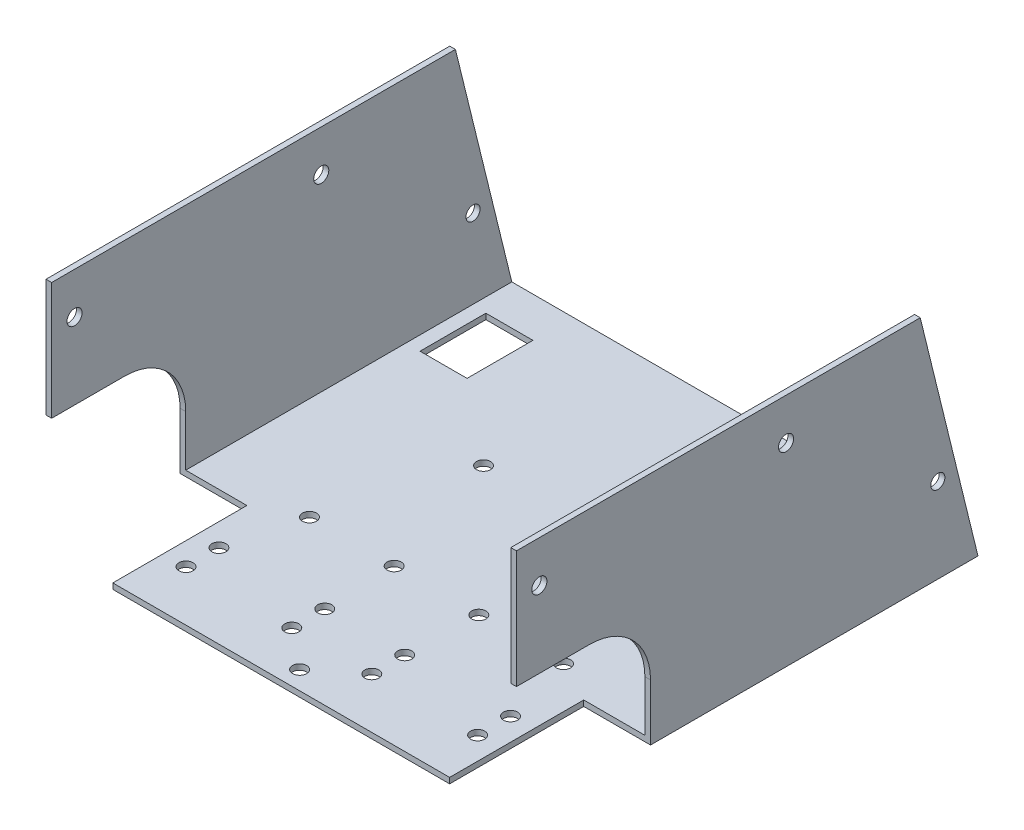
from build123d import *

# Parameters (mm, degrees)
SALIENTE_EXTRUIR1_DEPTH = 100
CROQUIS2_W              = 13
CROQUIS2_H              = 28.5
CORTAR_EXTRUIR2_DEPTH   = 10
CROQUIS3_R              = 1.5
CORTAR_EXTRUIR3_DEPTH   = 5
CROQUIS4_R              = 1.5
CORTAR_EXTRUIR4_DEPTH   = 10
CROQUIS5_R              = 1.5
CORTAR_EXTRUIR6_DEPTH   = 10
CORTAR_EXTRUIR8_DEPTH   = 151
CROQUIS7_W              = 1.2
CROQUIS7_H              = 2.5
CORTAR_EXTRUIR9_DEPTH   = 28.5
CROQUIS8_W              = 10
CROQUIS8_H              = 14
CORTAR_EXTRUIR10_DEPTH  = 10
CORTAR_EXTRUIR11_DEPTH  = 151
CROQUIS10_R             = 1.5
CORTAR_EXTRUIR12_DEPTH  = 149.746059648
CROQUIS11_R             = 1.6
CORTAR_EXTRUIR13_DEPTH  = 149.746059648


with BuildPart() as part:
    # Croquis1 → Saliente-Extruir1 (new body)
    with BuildSketch(Plane.XY):
        Polygon((50, 0), (-50, 0), (-50, 50), (-48.8, 50), (-48.8, 1.2), (48.8, 1.2), (48.8, 50), (50, 50), align=None)
    extrude(amount=-SALIENTE_EXTRUIR1_DEPTH)

    # Croquis2 → Cortar-Extruir2 (cut)
    with BuildSketch(Plane(origin=(0, 1.2, 0), x_dir=(1, 0, 0), z_dir=(0, 1, 0))):
        with Locations((-42.3, 14.25)):
            Rectangle(CROQUIS2_W, CROQUIS2_H)
        with Locations((42.3, 14.25)):
            Rectangle(CROQUIS2_W, CROQUIS2_H)
    extrude(amount=-CORTAR_EXTRUIR2_DEPTH, mode=Mode.SUBTRACT)

    # Croquis3 → Cortar-Extruir3 (cut)
    with BuildSketch(Plane(origin=(0, 1.2, 0), x_dir=(1, 0, 0), z_dir=(0, 1, 0))):
        with Locations((0, 3.9)):
            Circle(CROQUIS3_R)
    extrude(amount=-CORTAR_EXTRUIR3_DEPTH, mode=Mode.SUBTRACT)

    # Croquis4 → Cortar-Extruir4 (cut)
    with BuildSketch(Plane(origin=(0, 1.2, 0), x_dir=(1, 0, 0), z_dir=(0, 1, 0))):
        with Locations((-8.5, 17.75)):
            Circle(CROQUIS4_R)
        with Locations((-8.5, 10.75)):
            Circle(CROQUIS4_R)
        with Locations((8.5, 10.75)):
            Circle(CROQUIS4_R)
        with Locations((8.5, 17.75)):
            Circle(CROQUIS4_R)
        with Locations((-31, 17.75)):
            Circle(CROQUIS4_R)
        with Locations((-31, 10.75)):
            Circle(CROQUIS4_R)
        with Locations((31, 10.75)):
            Circle(CROQUIS4_R)
        with Locations((31, 17.75)):
            Circle(CROQUIS4_R)
    extrude(amount=-CORTAR_EXTRUIR4_DEPTH, mode=Mode.SUBTRACT)

    # Croquis5 → Cortar-Extruir6 (cut)
    with BuildSketch(Plane(origin=(0, 1.2, 0), x_dir=(1, 0, 0), z_dir=(0, 1, 0))):
        with Locations((-18, 61)):
            Circle(CROQUIS5_R)
        with Locations((-27, 33)):
            Circle(CROQUIS5_R)
        with Locations((27, 33)):
            Circle(CROQUIS5_R)
        with Locations((18, 61)):
            Circle(CROQUIS5_R)
        with Locations((-9, 33)):
            Circle(CROQUIS5_R)
        with Locations((9, 33)):
            Circle(CROQUIS5_R)
    extrude(amount=-CORTAR_EXTRUIR6_DEPTH, mode=Mode.SUBTRACT)

    # Croquis6 → Cortar-Extruir8 (cut, through all)
    with BuildSketch(Plane.ZY.offset(50)):
        with BuildLine():
            Line((0, 25), (0, 2.5))
            Line((0, 2.5), (-28.5, 2.5))
            Line((-28.5, 2.5), (-28.5, 12))
            ThreePointArc((-28.5, 12), (-24.692388155, 21.192388155), (-15.5, 25))
            Line((-15.5, 25), (0, 25))
        make_face()
    extrude(amount=-CORTAR_EXTRUIR8_DEPTH, mode=Mode.SUBTRACT)

    # Croquis7 → Cortar-Extruir9 (cut)
    with BuildSketch(Plane.XY):
        with Locations((49.4, 1.25)):
            Rectangle(CROQUIS7_W, CROQUIS7_H)
        with Locations((-49.4, 1.25)):
            Rectangle(CROQUIS7_W, CROQUIS7_H)
    extrude(amount=-CORTAR_EXTRUIR9_DEPTH, mode=Mode.SUBTRACT)

    # Croquis8 → Cortar-Extruir10 (cut)
    with BuildSketch(Plane(origin=(0, 1.2, 0), x_dir=(1, 0, 0), z_dir=(0, 1, 0))):
        with Locations((-40.8, 82.301695329)):
            Rectangle(CROQUIS8_W, CROQUIS8_H)
        with Locations((40.8, 82.301695329)):
            Rectangle(CROQUIS8_W, CROQUIS8_H)
    extrude(amount=-CORTAR_EXTRUIR10_DEPTH, mode=Mode.SUBTRACT)

    # Croquis9 → Cortar-Extruir11 (cut, through all)
    with BuildSketch(Plane.ZY.offset(50)):
        Polygon((-100, -2.8), (-98.930483034, -3.344181459), (-85.827895361, 50), (-100, 50), align=None)
    extrude(amount=-CORTAR_EXTRUIR11_DEPTH, mode=Mode.SUBTRACT)

    # Croquis10 → Cortar-Extruir12 (cut, through all)
    with BuildSketch(Plane.ZY.offset(50)):
        with Locations((-89.568954366, 18)):
            Circle(CROQUIS10_R)
    extrude(amount=-CORTAR_EXTRUIR12_DEPTH, mode=Mode.SUBTRACT)

    # Croquis11 → Cortar-Extruir13 (cut, through all)
    with BuildSketch(Plane.ZY.offset(50)):
        with Locations((-57.309073284, 41.2)):
            Circle(CROQUIS11_R)
        with Locations((-4.868840883, 41.2)):
            Circle(CROQUIS11_R)
    extrude(amount=-CORTAR_EXTRUIR13_DEPTH, mode=Mode.SUBTRACT)


solid = part.part
